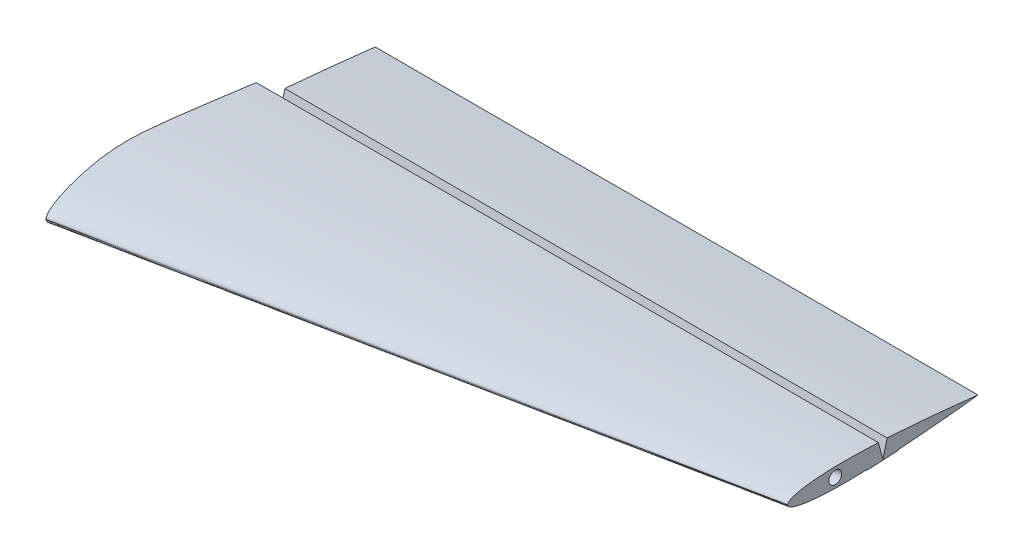
from build123d import *

# Parameters (mm, degrees)
CUT_EXTRUDE3_DEPTH      = 519.712361423
CUT_EXTRUDE3_DEPTH_BACK = 519.712361423
SKETCH14_R              = 5
CUT_EXTRUDE1_DEPTH      = 560.156743602
CUT_EXTRUDE1_DEPTH_BACK = 560.156743602
SKETCH10_W              = 25
SKETCH10_H              = 79.07223766
SKETCH11_R              = 13
CUT_EXTRUDE2_DEPTH      = 560.156743602
CUT_EXTRUDE4_DEPTH      = 5.2
CUT_EXTRUDE4_DEPTH_BACK = 558.998298609
SKETCH16_W              = 44
SKETCH16_H              = 44


with BuildPart() as part:
    # Sketch7 → Loft2 section 0
    with BuildSketch(Plane(origin=(500, 0, 0), x_dir=(0, 0, -1), z_dir=(1, 0, 0))):
        with BuildLine():
            add(Edge.make_bspline(
                [(-150, 0), (-149.999937168, 0.117458016), (-149.976690854, 0.362354041), (-149.855735538, 0.757950568), (-149.476892342, 1.343884103), (-148.865894277, 1.905141517), (-147.945661581, 2.509663886), (-146.476265497, 3.220015573), (-144.04432364, 4.090753893), (-139.704028605, 5.166773097), (-132.776680638, 6.26979221), (-123.484627866, 7.090651632), (-112.495358508, 7.519503098), (-100.569404353, 7.537422113), (-88.776783522, 7.262493565), (-76.789856001, 6.732528635), (-65.139317368, 6.064399479), (-52.963497284, 5.188719038), (-41.674684407, 4.298475849), (-28.949499412, 3.123024292), (-18.626485717, 2.12842443), (-7.922257682, 0.935284249), (-2.680333682, 0.324655417), (0, 0)],
                knots=[0, 0, 0, 0, 0, 0.0027914, 0.005882719, 0.009734657, 0.016522403, 0.022438151, 0.032158027, 0.04863424, 0.078248652, 0.129036717, 0.199997011, 0.270957307, 0.341917602, 0.412877898, 0.483838194, 0.554798491, 0.625758787, 0.696719083, 0.767679379, 0.838639675, 0.909599973, 0.909599973, 0.909599973, 0.909599973, 0.909599973], degree=4))
            add(Edge.make_bspline(
                [(-150, 0), (-149.999937169, -0.117458016), (-149.976690854, -0.362354041), (-149.855735538, -0.757950568), (-149.476892342, -1.343884103), (-148.865894277, -1.905141517), (-147.945661581, -2.509663886), (-146.476265497, -3.220015573), (-144.04432364, -4.090753893), (-139.704028605, -5.166773097), (-132.776680638, -6.26979221), (-123.484627866, -7.090651632), (-112.495358508, -7.519503098), (-100.569404353, -7.537422113), (-88.776783522, -7.262493565), (-76.789856001, -6.732528635), (-65.139317368, -6.064399479), (-52.963497285, -5.188719038), (-41.674684407, -4.298475849), (-28.949499412, -3.123024292), (-18.626485717, -2.12842443), (-7.922257682, -0.935284249), (-2.680333682, -0.324655417), (0, 0)],
                knots=[0, 0, 0, 0, 0, 0.0027914, 0.005882719, 0.009734657, 0.016522403, 0.022438151, 0.032158027, 0.04863424, 0.078248652, 0.129036717, 0.199997011, 0.270957307, 0.341917602, 0.412877898, 0.483838194, 0.554798491, 0.625758787, 0.696719083, 0.767679379, 0.838639675, 0.909599973, 0.909599973, 0.909599973, 0.909599973, 0.909599973], degree=4))
        make_face()
    # Sketch4 → Loft2 section 1
    with BuildSketch(Plane(origin=(0, 0, 0), x_dir=(0, 0, -1), z_dir=(1, 0, 0))):
        with BuildLine():
            add(Edge.make_bspline(
                [(-250, 0), (-249.999895281, 0.195763361), (-249.961151424, 0.603923402), (-249.75955923, 1.263250946), (-249.128153903, 2.239806839), (-248.109823795, 3.175235862), (-246.576102635, 4.182773144), (-244.127109162, 5.366692622), (-240.073872734, 6.817923154), (-232.840047676, 8.611288496), (-221.29446773, 10.449653683), (-205.80771311, 11.81775272), (-187.49226418, 12.532505163), (-167.615673922, 12.562370188), (-147.96130587, 12.104155942), (-127.983093335, 11.220881059), (-108.565528946, 10.107332464), (-88.272495474, 8.647865064), (-69.457807346, 7.164126414), (-48.249165687, 5.205040487), (-31.044142862, 3.54737405), (-13.203762803, 1.558807082), (-4.467222803, 0.541092362), (0, 0)],
                knots=[0, 0, 0, 0, 0, 0.0027914, 0.005882719, 0.009734657, 0.016522403, 0.022438151, 0.032158027, 0.04863424, 0.078248652, 0.129036717, 0.199997011, 0.270957307, 0.341917602, 0.412877898, 0.483838194, 0.554798491, 0.625758787, 0.696719083, 0.767679379, 0.838639675, 0.909599973, 0.909599973, 0.909599973, 0.909599973, 0.909599973], degree=4))
            add(Edge.make_bspline(
                [(-250, 0), (-249.999895281, -0.195763361), (-249.961151424, -0.603923402), (-249.75955923, -1.263250946), (-249.128153903, -2.239806839), (-248.109823795, -3.175235862), (-246.576102635, -4.182773144), (-244.127109162, -5.366692622), (-240.073872734, -6.817923154), (-232.840047676, -8.611288496), (-221.29446773, -10.449653683), (-205.80771311, -11.81775272), (-187.49226418, -12.532505163), (-167.615673922, -12.562370188), (-147.96130587, -12.104155942), (-127.983093335, -11.220881059), (-108.565528946, -10.107332464), (-88.272495474, -8.647865064), (-69.457807346, -7.164126414), (-48.249165687, -5.205040487), (-31.044142862, -3.54737405), (-13.203762803, -1.558807082), (-4.467222803, -0.541092362), (0, 0)],
                knots=[0, 0, 0, 0, 0, 0.0027914, 0.005882719, 0.009734657, 0.016522403, 0.022438151, 0.032158027, 0.04863424, 0.078248652, 0.129036717, 0.199997011, 0.270957307, 0.341917602, 0.412877898, 0.483838194, 0.554798491, 0.625758787, 0.696719083, 0.767679379, 0.838639675, 0.909599973, 0.909599973, 0.909599973, 0.909599973, 0.909599973], degree=4))
        make_face()
    loft()

    # Sketch9 → Cut-Loft1 section 0
    with BuildSketch(Plane(origin=(500, 0, 0), x_dir=(0, 0, -1), z_dir=(1, 0, 0))):
        with BuildLine():
            Line((-75, -6.383696601), (-79.092377838, 8.889265416))
            Line((-79.092377838, 8.889265416), (-70.907622162, 8.889265416))
            Line((-70.907622162, 8.889265416), (-75, -6.383696601))
        make_face()
    # Sketch8 → Cut-Loft1 section 1
    with BuildSketch(Plane.ZY):
        with BuildLine():
            Line((75, -7.292990882), (70.17329306, 10.72052465))
            Line((70.17329306, 10.72052465), (79.82670694, 10.72052465))
            Line((79.82670694, 10.72052465), (75, -7.292990882))
        make_face()
    loft(mode=Mode.SUBTRACT)

    # Sketch14 → Cut-Extrude3 (cut, two sides: drawn at the far end of the back side and taken through both)
    with BuildSketch(Plane(origin=(500, 0, 112.5), x_dir=(0.14834045293057432, 0, 0.9889363528682482), z_dir=(-0.9889363528682482, 0, 0.14834045293057432)).offset(-CUT_EXTRUDE3_DEPTH_BACK)):
        Circle(SKETCH14_R)
    extrude(amount=CUT_EXTRUDE3_DEPTH + CUT_EXTRUDE3_DEPTH_BACK, mode=Mode.SUBTRACT)

    # Sketch10 → Cut-Extrude1 (cut, two sides: drawn at the far end of the back side and taken through both)
    with BuildSketch(Plane(origin=(0, 0, 0), x_dir=(1, 0, 0), z_dir=(0, 1, 0)).offset(-CUT_EXTRUDE1_DEPTH_BACK)):
        with Locations((12.5, -39.53611883)):
            Rectangle(SKETCH10_W, SKETCH10_H)
    extrude(amount=CUT_EXTRUDE1_DEPTH + CUT_EXTRUDE1_DEPTH_BACK, mode=Mode.SUBTRACT)

    # Sketch11 → Cut-Extrude2 (cut, through all)
    with BuildSketch(Plane.XY):
        Circle(SKETCH11_R)
    extrude(amount=CUT_EXTRUDE2_DEPTH, mode=Mode.SUBTRACT)

    # Sketch16 → Cut-Extrude4 (cut, two sides: drawn at the far end of the back side and taken through both)
    with BuildSketch(Plane(origin=(0, 0, 0), x_dir=(1, 0, 0), z_dir=(0, 1, 0)).offset(-CUT_EXTRUDE4_DEPTH_BACK)):
        with Locations((52, -117)):
            Rectangle(SKETCH16_W, SKETCH16_H)
    extrude(amount=CUT_EXTRUDE4_DEPTH + CUT_EXTRUDE4_DEPTH_BACK, mode=Mode.SUBTRACT)

    # Sketch18 → Loft3 section 0
    with BuildSketch(Plane.ZY.offset(-25)):
        with BuildLine():
            Line((62.520225015, -6.482818336), (87.520225015, -8.58174864))
            Line((87.520225015, -8.58174864), (87.478246409, -9.08174864))
            Line((87.478246409, -9.08174864), (62.478246409, -6.982818336))
            Line((62.478246409, -6.982818336), (62.520225015, -6.482818336))
        make_face()
    # Sketch17 → Loft3 section 1
    with BuildSketch(Plane(origin=(500, 0, 0), x_dir=(0, 0, -1), z_dir=(1, 0, 0))):
        with BuildLine():
            Line((-87.476150939, -7.165814199), (-62.476150939, -5.852801761))
            Line((-62.476150939, -5.852801761), (-62.449926834, -6.352113583))
            Line((-62.449926834, -6.352113583), (-87.449926834, -7.665126021))
            Line((-87.449926834, -7.665126021), (-87.476150939, -7.165814199))
        make_face()
    loft()


solid = part.part
